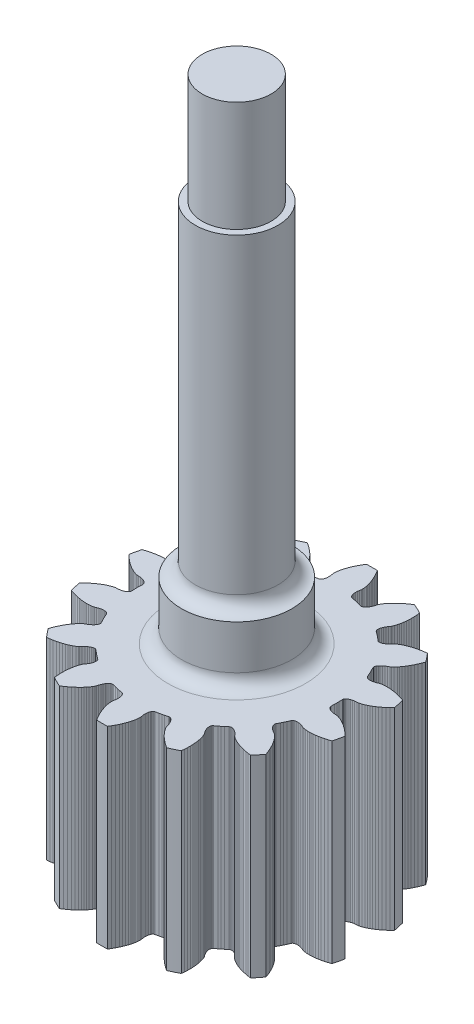
from build123d import *

# Parameters (mm, degrees)
SKETCH1_R           = 2
BOSS_EXTRUDE1_DEPTH = 2.1
SKETCH2_R           = 1.5
BOSS_EXTRUDE3_DEPTH = 15.8
BOSS_EXTRUDE4_DEPTH = 7
FILLET1_R           = 0.5
CUT_EXTRUDE3_START  = -4
SKETCH5_R           = 1.5
SKETCH5_R_2         = 1.25
CUT_EXTRUDE3_DEPTH  = 4


with BuildPart() as part:
    # Sketch1 → Boss-Extrude1 (new body)
    with BuildSketch(Plane(origin=(0, 0, 0), x_dir=(1, 0, 0), z_dir=(0, 1, 0))):
        with Locations(Location((0, 0, 0), (0, 0, 270))):
            Circle(SKETCH1_R)
    extrude(amount=BOSS_EXTRUDE1_DEPTH)

    # Sketch2 → Boss-Extrude3 (add)
    with BuildSketch(Plane(origin=(0, 2.1, 0), x_dir=(1, 0, 0), z_dir=(0, 1, 0))):
        with Locations(Location((0, 0, 0), (0, 0, 270))):
            Circle(SKETCH2_R)
    extrude(amount=BOSS_EXTRUDE3_DEPTH)

    # Sketch4 → Boss-Extrude4 (add)
    with BuildSketch(Plane.XZ):
        with BuildLine():
            Line((-3.859803511, -2.753642421), (-3.819636511, -2.656771321))
            Line((-3.819636511, -2.656771321), (-3.776760411, -2.564511521))
            Line((-3.776760411, -2.564511521), (-3.734616711, -2.483015421))
            Line((-3.734616711, -2.483015421), (-3.693090411, -2.410263021))
            Line((-3.693090411, -2.410263021), (-3.651178211, -2.343451621))
            Line((-3.651178211, -2.343451621), (-3.610740011, -2.284642221))
            Line((-3.610740011, -2.284642221), (-3.572343511, -2.233508821))
            Line((-3.572343511, -2.233508821), (-3.535491911, -2.188524621))
            Line((-3.535491911, -2.188524621), (-3.473146411, -2.121251821))
            Line((-3.473146411, -2.121251821), (-3.424934411, -2.077178821))
            Line((-3.424934411, -2.077178821), (-3.394910511, -2.054040521))
            Line((-3.394910511, -2.054040521), (-3.341224911, -2.025989321))
            Line((-3.341224911, -2.025989321), (-3.281336111, -1.989223521))
            Line((-3.281336111, -1.989223521), (-3.230434711, -1.951380621))
            Line((-3.230434711, -1.951380621), (-3.188477311, -1.913149921))
            Line((-3.188477311, -1.913149921), (-3.155406711, -1.875203321))
            Line((-3.155406711, -1.875203321), (-3.131116811, -1.838222021))
            Line((-3.131116811, -1.838222021), (-3.115447411, -1.802861521))
            Line((-3.115447411, -1.802861521), (-3.108211511, -1.769786521))
            Line((-3.108211511, -1.769786521), (-3.107677411, -1.754301221))
            Line((-3.107677411, -1.754301221), (-3.109172511, -1.739626721))
            Line((-3.109172511, -1.739626721), (-3.112653111, -1.725830621))
            Line((-3.112653111, -1.725830621), (-3.118075811, -1.713003121))
            Line((-3.118075811, -1.713003121), (-3.173896811, -1.608060321))
            Line((-3.173896811, -1.608060321), (-3.212259611, -1.530726921))
            Line((-3.212259611, -1.530726921), (-3.248802511, -1.452517121))
            Line((-3.248802511, -1.452517121), (-3.296046211, -1.343443721))
            Line((-3.296046211, -1.343443721), (-3.302694211, -1.331206321))
            Line((-3.302694211, -1.331206321), (-3.311310311, -1.319883321))
            Line((-3.311310311, -1.319883321), (-3.321851111, -1.309565021))
            Line((-3.321851111, -1.309565021), (-3.334291011, -1.300327721))
            Line((-3.334291011, -1.300327721), (-3.364661511, -1.285363021))
            Line((-3.364661511, -1.285363021), (-3.402077211, -1.275566921))
            Line((-3.402077211, -1.275566921), (-3.446134811, -1.271500121))
            Line((-3.446134811, -1.271500121), (-3.496421911, -1.273696321))
            Line((-3.496421911, -1.273696321), (-3.552471911, -1.282663521))
            Line((-3.552471911, -1.282663521), (-3.613795211, -1.298865121))
            Line((-3.613795211, -1.298865121), (-3.679879811, -1.322765021))
            Line((-3.679879811, -1.322765021), (-3.735283611, -1.347248421))
            Line((-3.735283611, -1.347248421), (-3.772093511, -1.356295621))
            Line((-3.772093511, -1.356295621), (-3.836610811, -1.366510221))
            Line((-3.836610811, -1.366510221), (-3.928078611, -1.373310021))
            Line((-3.928078611, -1.373310021), (-3.986225211, -1.374074621))
            Line((-3.986225211, -1.374074621), (-4.050142711, -1.372213021))
            Line((-4.050142711, -1.372213021), (-4.121334611, -1.367161721))
            Line((-4.121334611, -1.367161721), (-4.199701711, -1.358273821))
            Line((-4.199701711, -1.358273821), (-4.282473011, -1.345380021))
            Line((-4.282473011, -1.345380021), (-4.372465411, -1.327517321))
            Line((-4.372465411, -1.327517321), (-4.471329811, -1.303516121))
            Line((-4.471329811, -1.303516121), (-4.572110411, -1.274521821))
            Line((-4.572110411, -1.274521821), (-4.675267811, -1.240141921))
            ThreePointArc((-4.675267811, -1.240141921), (-4.723140522, -1.048323303), (-4.763235176, -0.854729404))
            Line((-4.763235176, -0.854729404), (-4.685210401, -0.778995911))
            Line((-4.685210401, -0.778995911), (-4.606990401, -0.709145911))
            Line((-4.606990401, -0.709145911), (-4.528330401, -0.644625911))
            Line((-4.528330401, -0.644625911), (-4.455000401, -0.589485911))
            Line((-4.455000401, -0.589485911), (-4.386020401, -0.541955911))
            Line((-4.386020401, -0.541955911), (-4.319270401, -0.499945911))
            Line((-4.319270401, -0.499945911), (-4.257320401, -0.464505911))
            Line((-4.257320401, -0.464505911), (-4.200540401, -0.435095911))
            Line((-4.200540401, -0.435095911), (-4.147820401, -0.410555911))
            Line((-4.147820401, -0.410555911), (-4.062460401, -0.376995911))
            Line((-4.062460401, -0.376995911), (-3.999900401, -0.358205911))
            Line((-3.999900401, -0.358205911), (-3.962810401, -0.350385911))
            Line((-3.962810401, -0.350385911), (-3.902270401, -0.348405911))
            Line((-3.902270401, -0.348405911), (-3.832360401, -0.341265911))
            Line((-3.832360401, -0.341265911), (-3.770080401, -0.329255911))
            Line((-3.770080401, -0.329255911), (-3.715690401, -0.313015911))
            Line((-3.715690401, -0.313015911), (-3.669430401, -0.293175911))
            Line((-3.669430401, -0.293175911), (-3.631500401, -0.270395911))
            Line((-3.631500401, -0.270395911), (-3.602040401, -0.245335911))
            Line((-3.602040401, -0.245335911), (-3.581170401, -0.218675911))
            Line((-3.581170401, -0.218675911), (-3.573970401, -0.204955911))
            Line((-3.573970401, -0.204955911), (-3.568950401, -0.191085911))
            Line((-3.568950401, -0.191085911), (-3.566100401, -0.177145911))
            Line((-3.566100401, -0.177145911), (-3.565420401, -0.163235911))
            Line((-3.565420401, -0.163235911), (-3.570180401, -0.044465911))
            Line((-3.570180401, -0.044465911), (-3.571190401, 0.041854089))
            Line((-3.571190401, 0.041854089), (-3.570180401, 0.128174089))
            Line((-3.570180401, 0.128174089), (-3.565420401, 0.246944089))
            Line((-3.565420401, 0.246944089), (-3.566100401, 0.260854089))
            Line((-3.566100401, 0.260854089), (-3.568950401, 0.274794089))
            Line((-3.568950401, 0.274794089), (-3.573970401, 0.288664089))
            Line((-3.573970401, 0.288664089), (-3.581170401, 0.302384089))
            Line((-3.581170401, 0.302384089), (-3.602040401, 0.329044089))
            Line((-3.602040401, 0.329044089), (-3.631500401, 0.354104089))
            Line((-3.631500401, 0.354104089), (-3.669430401, 0.376884089))
            Line((-3.669430401, 0.376884089), (-3.715690401, 0.396724089))
            Line((-3.715690401, 0.396724089), (-3.770080401, 0.412964089))
            Line((-3.770080401, 0.412964089), (-3.832360401, 0.424974089))
            Line((-3.832360401, 0.424974089), (-3.902270401, 0.432114089))
            Line((-3.902270401, 0.432114089), (-3.962810401, 0.434094089))
            Line((-3.962810401, 0.434094089), (-3.999900401, 0.441914089))
            Line((-3.999900401, 0.441914089), (-4.062460401, 0.460704089))
            Line((-4.062460401, 0.460704089), (-4.147820401, 0.494264089))
            Line((-4.147820401, 0.494264089), (-4.200540401, 0.518804089))
            Line((-4.200540401, 0.518804089), (-4.257320401, 0.548214089))
            Line((-4.257320401, 0.548214089), (-4.319270401, 0.583654089))
            Line((-4.319270401, 0.583654089), (-4.386020401, 0.625664089))
            Line((-4.386020401, 0.625664089), (-4.455000401, 0.673194089))
            Line((-4.455000401, 0.673194089), (-4.528330401, 0.728334089))
            Line((-4.528330401, 0.728334089), (-4.606990401, 0.792854089))
            Line((-4.606990401, 0.792854089), (-4.685210401, 0.862704089))
            Line((-4.685210401, 0.862704089), (-4.763235101, 0.938437589))
            ThreePointArc((-4.763235101, 0.938437589), (-4.723141362, 1.13202383), (-4.675270179, 1.32383491))
            Line((-4.675270179, 1.32383491), (-4.572112903, 1.358214815))
            Line((-4.572112903, 1.358214815), (-4.471332303, 1.387209115))
            Line((-4.471332303, 1.387209115), (-4.372467903, 1.411210315))
            Line((-4.372467903, 1.411210315), (-4.282475503, 1.429073015))
            Line((-4.282475503, 1.429073015), (-4.199704203, 1.441966815))
            Line((-4.199704203, 1.441966815), (-4.121337103, 1.450854715))
            Line((-4.121337103, 1.450854715), (-4.050145203, 1.455906015))
            Line((-4.050145203, 1.455906015), (-3.986227703, 1.457767615))
            Line((-3.986227703, 1.457767615), (-3.928081103, 1.457003015))
            Line((-3.928081103, 1.457003015), (-3.836613303, 1.450203215))
            Line((-3.836613303, 1.450203215), (-3.772096003, 1.439988615))
            Line((-3.772096003, 1.439988615), (-3.735286103, 1.430941415))
            Line((-3.735286103, 1.430941415), (-3.679882303, 1.406458015))
            Line((-3.679882303, 1.406458015), (-3.613797703, 1.382558115))
            Line((-3.613797703, 1.382558115), (-3.552474403, 1.366356515))
            Line((-3.552474403, 1.366356515), (-3.496424403, 1.357389315))
            Line((-3.496424403, 1.357389315), (-3.446137303, 1.355193115))
            Line((-3.446137303, 1.355193115), (-3.402079703, 1.359259915))
            Line((-3.402079703, 1.359259915), (-3.364664003, 1.369056015))
            Line((-3.364664003, 1.369056015), (-3.334293503, 1.384020715))
            Line((-3.334293503, 1.384020715), (-3.321853603, 1.393258015))
            Line((-3.321853603, 1.393258015), (-3.311312803, 1.403576315))
            Line((-3.311312803, 1.403576315), (-3.302696703, 1.414899315))
            Line((-3.302696703, 1.414899315), (-3.296048703, 1.427136715))
            Line((-3.296048703, 1.427136715), (-3.248805003, 1.536210115))
            Line((-3.248805003, 1.536210115), (-3.212262103, 1.614419915))
            Line((-3.212262103, 1.614419915), (-3.173899303, 1.691753315))
            Line((-3.173899303, 1.691753315), (-3.118078303, 1.796696115))
            Line((-3.118078303, 1.796696115), (-3.112655603, 1.809523615))
            Line((-3.112655603, 1.809523615), (-3.109175003, 1.823319715))
            Line((-3.109175003, 1.823319715), (-3.107679903, 1.837994215))
            Line((-3.107679903, 1.837994215), (-3.108214003, 1.853479515))
            Line((-3.108214003, 1.853479515), (-3.115449903, 1.886554515))
            Line((-3.115449903, 1.886554515), (-3.131119303, 1.921915015))
            Line((-3.131119303, 1.921915015), (-3.155409203, 1.958896315))
            Line((-3.155409203, 1.958896315), (-3.188479803, 1.996842915))
            Line((-3.188479803, 1.996842915), (-3.230437203, 2.035073615))
            Line((-3.230437203, 2.035073615), (-3.281338603, 2.072916515))
            Line((-3.281338603, 2.072916515), (-3.341227403, 2.109682315))
            Line((-3.341227403, 2.109682315), (-3.394913003, 2.137733515))
            Line((-3.394913003, 2.137733515), (-3.424936903, 2.160871815))
            Line((-3.424936903, 2.160871815), (-3.473148903, 2.204944815))
            Line((-3.473148903, 2.204944815), (-3.535494403, 2.272217615))
            Line((-3.535494403, 2.272217615), (-3.572346003, 2.317201815))
            Line((-3.572346003, 2.317201815), (-3.610742503, 2.368335215))
            Line((-3.610742503, 2.368335215), (-3.651180703, 2.427144615))
            Line((-3.651180703, 2.427144615), (-3.693092903, 2.493956015))
            Line((-3.693092903, 2.493956015), (-3.734619203, 2.566708415))
            Line((-3.734619203, 2.566708415), (-3.776762903, 2.648204515))
            Line((-3.776762903, 2.648204515), (-3.819639003, 2.740464315))
            Line((-3.819639003, 2.740464315), (-3.859806003, 2.837335415))
            Line((-3.859806003, 2.837335415), (-3.897244203, 2.939422615))
            ThreePointArc((-3.897244203, 2.939422615), (-3.777122614, 3.096447815), (-3.650763527, 3.248498762))
            Line((-3.650763527, 3.248498762), (-3.542905072, 3.234715701))
            Line((-3.542905072, 3.234715701), (-3.439524772, 3.217111601))
            Line((-3.439524772, 3.217111601), (-3.340037372, 3.195840301))
            Line((-3.340037372, 3.195840301), (-3.251206672, 3.172887901))
            Line((-3.251206672, 3.172887901), (-3.171037872, 3.148591601))
            Line((-3.171037872, 3.148591601), (-3.096575172, 3.122597101))
            Line((-3.096575172, 3.122597101), (-3.030241872, 3.096259201))
            Line((-3.030241872, 3.096259201), (-2.971846472, 3.070203601))
            Line((-2.971846472, 3.070203601), (-2.919789972, 3.044285901))
            Line((-2.919789972, 3.044285901), (-2.840330572, 2.998473101))
            Line((-2.840330572, 2.998473101), (-2.786634472, 2.961277101))
            Line((-2.786634472, 2.961277101), (-2.757395272, 2.937154601))
            Line((-2.757395272, 2.937154601), (-2.718101172, 2.891057101))
            Line((-2.718101172, 2.891057101), (-2.668930772, 2.840850901))
            Line((-2.668930772, 2.840850901), (-2.620709972, 2.799646601))
            Line((-2.620709972, 2.799646601), (-2.574101472, 2.767248201))
            Line((-2.574101472, 2.767248201), (-2.529747272, 2.743450801))
            Line((-2.529747272, 2.743450801), (-2.488288172, 2.727999001))
            Line((-2.488288172, 2.727999001), (-2.450327472, 2.720590901))
            Line((-2.450327472, 2.720590901), (-2.416471572, 2.720896301))
            Line((-2.416471572, 2.720896301), (-2.401255772, 2.723821401))
            Line((-2.401255772, 2.723821401), (-2.387281872, 2.728544401))
            Line((-2.387281872, 2.728544401), (-2.374606172, 2.735007601))
            Line((-2.374606172, 2.735007601), (-2.363306872, 2.743148701))
            Line((-2.363306872, 2.743148701), (-2.273416572, 2.820922101))
            Line((-2.273416572, 2.820922101), (-2.206558672, 2.875531401))
            Line((-2.206558672, 2.875531401), (-2.138441172, 2.928561401))
            Line((-2.138441172, 2.928561401), (-2.042615272, 2.998891801))
            Line((-2.042615272, 2.998891801), (-2.032163972, 3.008096201))
            Line((-2.032163972, 3.008096201), (-2.023042172, 3.019015801))
            Line((-2.023042172, 3.019015801), (-2.015328072, 3.031588401))
            Line((-2.015328072, 3.031588401), (-2.009090472, 3.045771901))
            Line((-2.009090472, 3.045771901), (-2.001259072, 3.078711001))
            Line((-2.001259072, 3.078711001), (-2.000034372, 3.117368401))
            Line((-2.000034372, 3.117368401), (-2.005873272, 3.161226301))
            Line((-2.005873272, 3.161226301), (-2.019204372, 3.209763901))
            Line((-2.019204372, 3.209763901), (-2.040419072, 3.262413201))
            Line((-2.040419072, 3.262413201), (-2.069860172, 3.318593801))
            Line((-2.069860172, 3.318593801), (-2.107866072, 3.377703301))
            Line((-2.107866072, 3.377703301), (-2.144064172, 3.426269901))
            Line((-2.144064172, 3.426269901), (-2.161075472, 3.460143701))
            Line((-2.161075472, 3.460143701), (-2.185390372, 3.520770501))
            Line((-2.185390372, 3.520770501), (-2.212373172, 3.608431901))
            Line((-2.212373172, 3.608431901), (-2.226057372, 3.664950501))
            Line((-2.226057372, 3.664950501), (-2.238465472, 3.727679801))
            Line((-2.238465472, 3.727679801), (-2.249382572, 3.798210701))
            Line((-2.249382572, 3.798210701), (-2.258155772, 3.876590801))
            Line((-2.258155772, 3.876590801), (-2.264003672, 3.960156001))
            Line((-2.264003672, 3.960156001), (-2.266613972, 4.051866901))
            Line((-2.266613972, 4.051866901), (-2.265213972, 4.153593301))
            Line((-2.265213972, 4.153593301), (-2.259372372, 4.258298901))
            Line((-2.259372372, 4.258298901), (-2.248809072, 4.366520201))
            ThreePointArc((-2.248809072, 4.366520201), (-2.0724582, 4.455873191), (-1.892646011, 4.538038654))
            Line((-1.892646011, 4.538038654), (-1.801449089, 4.478822413))
            Line((-1.801449089, 4.478822413), (-1.715944789, 4.418106613))
            Line((-1.715944789, 4.418106613), (-1.635538989, 4.355775913))
            Line((-1.635538989, 4.355775913), (-1.565463989, 4.296554213))
            Line((-1.565463989, 4.296554213), (-1.503776189, 4.239880113))
            Line((-1.503776189, 4.239880113), (-1.447966189, 4.184151813))
            Line((-1.447966189, 4.184151813), (-1.399629589, 4.131641113))
            Line((-1.399629589, 4.131641113), (-1.358322189, 4.082829013))
            Line((-1.358322189, 4.082829013), (-1.322666189, 4.036891513))
            Line((-1.322666189, 4.036891513), (-1.270953189, 3.961139513))
            Line((-1.270953189, 3.961139513), (-1.238713389, 3.904329113))
            Line((-1.238713389, 3.904329113), (-1.222836189, 3.869909213))
            Line((-1.222836189, 3.869909213), (-1.207434389, 3.811327613))
            Line((-1.207434389, 3.811327613), (-1.184916989, 3.744759213))
            Line((-1.184916989, 3.744759213), (-1.159349489, 3.686713213))
            Line((-1.159349489, 3.686713213), (-1.131413689, 3.637300613))
            Line((-1.131413689, 3.637300613), (-1.101777289, 3.596615313))
            Line((-1.101777289, 3.596615313), (-1.071128289, 3.564705313))
            Line((-1.071128289, 3.564705313), (-1.040141089, 3.541560313))
            Line((-1.040141089, 3.541560313), (-1.009505489, 3.527145913))
            Line((-1.009505489, 3.527145913), (-0.994527389, 3.523179413))
            Line((-0.994527389, 3.523179413), (-0.979888089, 3.521371713))
            Line((-0.979888089, 3.521371713), (-0.965663389, 3.521695113))
            Line((-0.965663389, 3.521695113), (-0.951950789, 3.524127413))
            Line((-0.951950789, 3.524127413), (-0.837217789, 3.555196813))
            Line((-0.837217789, 3.555196813), (-0.753286789, 3.575389513))
            Line((-0.753286789, 3.575389513), (-0.668906289, 3.593612913))
            Line((-0.668906289, 3.593612913), (-0.552054889, 3.615401013))
            Line((-0.552054889, 3.615401013), (-0.538644889, 3.619159213))
            Line((-0.538644889, 3.619159213), (-0.525688589, 3.625039713))
            Line((-0.525688589, 3.625039713), (-0.513283389, 3.633020213))
            Line((-0.513283389, 3.633020213), (-0.501509589, 3.643092713))
            Line((-0.501509589, 3.643092713), (-0.480161989, 3.669371813))
            Line((-0.480161989, 3.669371813), (-0.462285789, 3.703669613))
            Line((-0.462285789, 3.703669613), (-0.448517189, 3.745717613))
            Line((-0.448517189, 3.745717613), (-0.439468389, 3.795232613))
            Line((-0.439468389, 3.795232613), (-0.435738489, 3.851872713))
            Line((-0.435738489, 3.851872713), (-0.437888189, 3.915263713))
            Line((-0.437888189, 3.915263713), (-0.446483689, 3.985009713))
            Line((-0.446483689, 3.985009713), (-0.458024689, 4.044472413))
            Line((-0.458024689, 4.044472413), (-0.458654089, 4.082372613))
            Line((-0.458654089, 4.082372613), (-0.454256089, 4.147545313))
            Line((-0.454256089, 4.147545313), (-0.440531889, 4.238232913))
            Line((-0.440531889, 4.238232913), (-0.428338489, 4.295091813))
            Line((-0.428338489, 4.295091813), (-0.412300589, 4.356992513))
            Line((-0.412300589, 4.356992513), (-0.391534289, 4.425275413))
            Line((-0.391534289, 4.425275413), (-0.365430889, 4.499700013))
            Line((-0.365430889, 4.499700013), (-0.334441989, 4.577526913))
            Line((-0.334441989, 4.577526913), (-0.297001989, 4.661288213))
            Line((-0.297001989, 4.661288213), (-0.251603089, 4.752333113))
            Line((-0.251603089, 4.752333113), (-0.200909989, 4.844135013))
            Line((-0.200909989, 4.844135013), (-0.144437389, 4.937055813))
            ThreePointArc((-0.144437389, 4.937055813), (0.053217989, 4.941044579), (0.250873367, 4.937055805))
            Line((0.250873367, 4.937055805), (0.307345967, 4.844134979))
            Line((0.307345967, 4.844134979), (0.358039167, 4.752333079))
            Line((0.358039167, 4.752333079), (0.403437967, 4.661288179))
            Line((0.403437967, 4.661288179), (0.440878067, 4.577526879))
            Line((0.440878067, 4.577526879), (0.471866867, 4.499699979))
            Line((0.471866867, 4.499699979), (0.497970367, 4.425275379))
            Line((0.497970367, 4.425275379), (0.518736567, 4.356992479))
            Line((0.518736567, 4.356992479), (0.534774467, 4.295091779))
            Line((0.534774467, 4.295091779), (0.546967967, 4.238232879))
            Line((0.546967967, 4.238232879), (0.560692167, 4.147545279))
            Line((0.560692167, 4.147545279), (0.565090067, 4.082372579))
            Line((0.565090067, 4.082372579), (0.564460767, 4.044472379))
            Line((0.564460767, 4.044472379), (0.552919667, 3.985009679))
            Line((0.552919667, 3.985009679), (0.544324267, 3.915263679))
            Line((0.544324267, 3.915263679), (0.542174467, 3.851872679))
            Line((0.542174467, 3.851872679), (0.545904467, 3.795232579))
            Line((0.545904467, 3.795232579), (0.554953167, 3.745717579))
            Line((0.554953167, 3.745717579), (0.568721867, 3.703669579))
            Line((0.568721867, 3.703669579), (0.586598067, 3.669371779))
            Line((0.586598067, 3.669371779), (0.607945567, 3.643092679))
            Line((0.607945567, 3.643092679), (0.619719467, 3.633020179))
            Line((0.619719467, 3.633020179), (0.632124667, 3.625039679))
            Line((0.632124667, 3.625039679), (0.645080967, 3.619159179))
            Line((0.645080967, 3.619159179), (0.658490867, 3.615400979))
            Line((0.658490867, 3.615400979), (0.775342267, 3.593612879))
            Line((0.775342267, 3.593612879), (0.859722867, 3.575389479))
            Line((0.859722867, 3.575389479), (0.943653867, 3.555196779))
            Line((0.943653867, 3.555196779), (1.058386867, 3.524127379))
            Line((1.058386867, 3.524127379), (1.072099367, 3.521695079))
            Line((1.072099367, 3.521695079), (1.086324067, 3.521371679))
            Line((1.086324067, 3.521371679), (1.100963367, 3.523179379))
            Line((1.100963367, 3.523179379), (1.115941567, 3.527145879))
            Line((1.115941567, 3.527145879), (1.146577167, 3.541560279))
            Line((1.146577167, 3.541560279), (1.177564267, 3.564705279))
            Line((1.177564267, 3.564705279), (1.208213367, 3.596615279))
            Line((1.208213367, 3.596615279), (1.237849767, 3.637300579))
            Line((1.237849767, 3.637300579), (1.265785467, 3.686713179))
            Line((1.265785467, 3.686713179), (1.291352967, 3.744759179))
            Line((1.291352967, 3.744759179), (1.313870467, 3.811327579))
            Line((1.313870467, 3.811327579), (1.329272167, 3.869909179))
            Line((1.329272167, 3.869909179), (1.345149467, 3.904329079))
            Line((1.345149467, 3.904329079), (1.377389267, 3.961139479))
            Line((1.377389267, 3.961139479), (1.429102167, 4.036891479))
            Line((1.429102167, 4.036891479), (1.464758267, 4.082828979))
            Line((1.464758267, 4.082828979), (1.506065567, 4.131641079))
            Line((1.506065567, 4.131641079), (1.554402267, 4.184151779))
            Line((1.554402267, 4.184151779), (1.610212267, 4.239880079))
            Line((1.610212267, 4.239880079), (1.671900067, 4.296554179))
            Line((1.671900067, 4.296554179), (1.741975067, 4.355775879))
            Line((1.741975067, 4.355775879), (1.822380867, 4.418106579))
            Line((1.822380867, 4.418106579), (1.907885167, 4.478822379))
            Line((1.907885167, 4.478822379), (1.999094892, 4.53803307))
            ThreePointArc((1.999094892, 4.53803307), (2.178906842, 4.455867084), (2.355257454, 4.366513581))
            Line((2.355257454, 4.366513581), (2.365820736, 4.25829224))
            Line((2.365820736, 4.25829224), (2.371662236, 4.15358664))
            Line((2.371662236, 4.15358664), (2.373062336, 4.05186024))
            Line((2.373062336, 4.05186024), (2.370452036, 3.96014934))
            Line((2.370452036, 3.96014934), (2.364604136, 3.87658414))
            Line((2.364604136, 3.87658414), (2.355830936, 3.79820404))
            Line((2.355830936, 3.79820404), (2.344913836, 3.72767314))
            Line((2.344913836, 3.72767314), (2.332505736, 3.66494384))
            Line((2.332505736, 3.66494384), (2.318821536, 3.60842524))
            Line((2.318821536, 3.60842524), (2.291838636, 3.52076384))
            Line((2.291838636, 3.52076384), (2.267523736, 3.46013704))
            Line((2.267523736, 3.46013704), (2.250512436, 3.42626324))
            Line((2.250512436, 3.42626324), (2.214314436, 3.37769664))
            Line((2.214314436, 3.37769664), (2.176308536, 3.31858714))
            Line((2.176308536, 3.31858714), (2.146867336, 3.26240654))
            Line((2.146867336, 3.26240654), (2.125652736, 3.20975724))
            Line((2.125652736, 3.20975724), (2.112321636, 3.16121964))
            Line((2.112321636, 3.16121964), (2.106482736, 3.11736174))
            Line((2.106482736, 3.11736174), (2.107707436, 3.07870434))
            Line((2.107707436, 3.07870434), (2.115538836, 3.04576524))
            Line((2.115538836, 3.04576524), (2.121776436, 3.03158174))
            Line((2.121776436, 3.03158174), (2.129490536, 3.01900914))
            Line((2.129490536, 3.01900914), (2.138612336, 3.00808954))
            Line((2.138612336, 3.00808954), (2.149063636, 2.99888514))
            Line((2.149063636, 2.99888514), (2.244889536, 2.92855474))
            Line((2.244889536, 2.92855474), (2.313006936, 2.87552474))
            Line((2.313006936, 2.87552474), (2.379864936, 2.82091544))
            Line((2.379864936, 2.82091544), (2.469755236, 2.74314204))
            Line((2.469755236, 2.74314204), (2.481054436, 2.73500094))
            Line((2.481054436, 2.73500094), (2.493730136, 2.72853774))
            Line((2.493730136, 2.72853774), (2.507704036, 2.72381474))
            Line((2.507704036, 2.72381474), (2.522919936, 2.72088964))
            Line((2.522919936, 2.72088964), (2.556775836, 2.72058424))
            Line((2.556775836, 2.72058424), (2.594736536, 2.72799234))
            Line((2.594736536, 2.72799234), (2.636195636, 2.74344414))
            Line((2.636195636, 2.74344414), (2.680549736, 2.76724154))
            Line((2.680549736, 2.76724154), (2.727158336, 2.79963994))
            Line((2.727158336, 2.79963994), (2.775379036, 2.84084424))
            Line((2.775379036, 2.84084424), (2.824549536, 2.89105044))
            Line((2.824549536, 2.89105044), (2.863843636, 2.93714794))
            Line((2.863843636, 2.93714794), (2.893082736, 2.96127044))
            Line((2.893082736, 2.96127044), (2.946778936, 2.99846644))
            Line((2.946778936, 2.99846644), (3.026238236, 3.04427924))
            Line((3.026238236, 3.04427924), (3.078294836, 3.07019694))
            Line((3.078294836, 3.07019694), (3.136690236, 3.09625254))
            Line((3.136690236, 3.09625254), (3.203023536, 3.12259044))
            Line((3.203023536, 3.12259044), (3.277486236, 3.14858494))
            Line((3.277486236, 3.14858494), (3.357654936, 3.17288124))
            Line((3.357654936, 3.17288124), (3.446485636, 3.19583364))
            Line((3.446485636, 3.19583364), (3.545973136, 3.21710494))
            Line((3.545973136, 3.21710494), (3.649353436, 3.23470904))
            Line((3.649353436, 3.23470904), (3.757211936, 3.24849214))
            ThreePointArc((3.757211936, 3.24849214), (3.88356659, 3.096445896), (4.003684153, 2.939425739))
            Line((4.003684153, 2.939425739), (3.966245901, 2.837338572))
            Line((3.966245901, 2.837338572), (3.926078901, 2.740467472))
            Line((3.926078901, 2.740467472), (3.883202901, 2.648207672))
            Line((3.883202901, 2.648207672), (3.841059201, 2.566711572))
            Line((3.841059201, 2.566711572), (3.799532801, 2.493959172))
            Line((3.799532801, 2.493959172), (3.757620601, 2.427147772))
            Line((3.757620601, 2.427147772), (3.717182401, 2.368338372))
            Line((3.717182401, 2.368338372), (3.678786001, 2.317204972))
            Line((3.678786001, 2.317204972), (3.641934401, 2.272220772))
            Line((3.641934401, 2.272220772), (3.579588801, 2.204947972))
            Line((3.579588801, 2.204947972), (3.531376901, 2.160874972))
            Line((3.531376901, 2.160874972), (3.501352901, 2.137736672))
            Line((3.501352901, 2.137736672), (3.447667301, 2.109685472))
            Line((3.447667301, 2.109685472), (3.387778501, 2.072919672))
            Line((3.387778501, 2.072919672), (3.336877101, 2.035076772))
            Line((3.336877101, 2.035076772), (3.294919701, 1.996846072))
            Line((3.294919701, 1.996846072), (3.261849201, 1.958899472))
            Line((3.261849201, 1.958899472), (3.237559301, 1.921918172))
            Line((3.237559301, 1.921918172), (3.221889901, 1.886557672))
            Line((3.221889901, 1.886557672), (3.214654001, 1.853482672))
            Line((3.214654001, 1.853482672), (3.214119901, 1.837997372))
            Line((3.214119901, 1.837997372), (3.215615001, 1.823322872))
            Line((3.215615001, 1.823322872), (3.219095601, 1.809526772))
            Line((3.219095601, 1.809526772), (3.224518201, 1.796699272))
            Line((3.224518201, 1.796699272), (3.280339201, 1.691756472))
            Line((3.280339201, 1.691756472), (3.318702001, 1.614423072))
            Line((3.318702001, 1.614423072), (3.355244901, 1.536213272))
            Line((3.355244901, 1.536213272), (3.402488701, 1.427139872))
            Line((3.402488701, 1.427139872), (3.409136701, 1.414902472))
            Line((3.409136701, 1.414902472), (3.417752801, 1.403579472))
            Line((3.417752801, 1.403579472), (3.428293601, 1.393261172))
            Line((3.428293601, 1.393261172), (3.440733401, 1.384023872))
            Line((3.440733401, 1.384023872), (3.471104001, 1.369059172))
            Line((3.471104001, 1.369059172), (3.508519701, 1.359263072))
            Line((3.508519701, 1.359263072), (3.552577301, 1.355196272))
            Line((3.552577301, 1.355196272), (3.602864401, 1.357392472))
            Line((3.602864401, 1.357392472), (3.658914301, 1.366359672))
            Line((3.658914301, 1.366359672), (3.720237601, 1.382561272))
            Line((3.720237601, 1.382561272), (3.786322301, 1.406461172))
            Line((3.786322301, 1.406461172), (3.841726001, 1.430944572))
            Line((3.841726001, 1.430944572), (3.878535901, 1.439991772))
            Line((3.878535901, 1.439991772), (3.943053201, 1.450206372))
            Line((3.943053201, 1.450206372), (4.034521101, 1.457006172))
            Line((4.034521101, 1.457006172), (4.092667701, 1.457770772))
            Line((4.092667701, 1.457770772), (4.156585201, 1.455909172))
            Line((4.156585201, 1.455909172), (4.227777001, 1.450857872))
            Line((4.227777001, 1.450857872), (4.306144201, 1.441969972))
            Line((4.306144201, 1.441969972), (4.388915501, 1.429076172))
            Line((4.388915501, 1.429076172), (4.478907901, 1.411213472))
            Line((4.478907901, 1.411213472), (4.577772301, 1.387212272))
            Line((4.577772301, 1.387212272), (4.678552901, 1.358217972))
            Line((4.678552901, 1.358217972), (4.781710106, 1.323838127))
            ThreePointArc((4.781710106, 1.323838127), (4.829581632, 1.132025926), (4.869675624, 0.938438543))
            Line((4.869675624, 0.938438543), (4.791653584, 0.862691003))
            Line((4.791653584, 0.862691003), (4.713433584, 0.792841003))
            Line((4.713433584, 0.792841003), (4.634773584, 0.728321003))
            Line((4.634773584, 0.728321003), (4.561443584, 0.673181003))
            Line((4.561443584, 0.673181003), (4.492463584, 0.625651003))
            Line((4.492463584, 0.625651003), (4.425713584, 0.583641003))
            Line((4.425713584, 0.583641003), (4.363763584, 0.548201003))
            Line((4.363763584, 0.548201003), (4.306983584, 0.518791003))
            Line((4.306983584, 0.518791003), (4.254263584, 0.494251003))
            Line((4.254263584, 0.494251003), (4.168903584, 0.460691003))
            Line((4.168903584, 0.460691003), (4.106343584, 0.441901003))
            Line((4.106343584, 0.441901003), (4.069253584, 0.434081003))
            Line((4.069253584, 0.434081003), (4.008713584, 0.432101003))
            Line((4.008713584, 0.432101003), (3.938803584, 0.424961003))
            Line((3.938803584, 0.424961003), (3.876523584, 0.412951003))
            Line((3.876523584, 0.412951003), (3.822133584, 0.396711003))
            Line((3.822133584, 0.396711003), (3.775873584, 0.376871003))
            Line((3.775873584, 0.376871003), (3.737943584, 0.354091003))
            Line((3.737943584, 0.354091003), (3.708483584, 0.329031003))
            Line((3.708483584, 0.329031003), (3.687613584, 0.302371003))
            Line((3.687613584, 0.302371003), (3.680413584, 0.288651003))
            Line((3.680413584, 0.288651003), (3.675393584, 0.274781003))
            Line((3.675393584, 0.274781003), (3.672543584, 0.260841003))
            Line((3.672543584, 0.260841003), (3.671863584, 0.246931003))
            Line((3.671863584, 0.246931003), (3.676623584, 0.128161003))
            Line((3.676623584, 0.128161003), (3.677633584, 0.041841003))
            Line((3.677633584, 0.041841003), (3.676623584, -0.044478997))
            Line((3.676623584, -0.044478997), (3.671863584, -0.163248997))
            Line((3.671863584, -0.163248997), (3.672543584, -0.177158997))
            Line((3.672543584, -0.177158997), (3.675393584, -0.191098997))
            Line((3.675393584, -0.191098997), (3.680413584, -0.204968997))
            Line((3.680413584, -0.204968997), (3.687613584, -0.218688997))
            Line((3.687613584, -0.218688997), (3.708483584, -0.245348997))
            Line((3.708483584, -0.245348997), (3.737943584, -0.270408997))
            Line((3.737943584, -0.270408997), (3.775873584, -0.293188997))
            Line((3.775873584, -0.293188997), (3.822133584, -0.313028997))
            Line((3.822133584, -0.313028997), (3.876523584, -0.329268997))
            Line((3.876523584, -0.329268997), (3.938803584, -0.341278997))
            Line((3.938803584, -0.341278997), (4.008713584, -0.348418997))
            Line((4.008713584, -0.348418997), (4.069253584, -0.350398997))
            Line((4.069253584, -0.350398997), (4.106343584, -0.358218997))
            Line((4.106343584, -0.358218997), (4.168903584, -0.377008997))
            Line((4.168903584, -0.377008997), (4.254263584, -0.410568997))
            Line((4.254263584, -0.410568997), (4.306983584, -0.435108997))
            Line((4.306983584, -0.435108997), (4.363763584, -0.464518997))
            Line((4.363763584, -0.464518997), (4.425713584, -0.499958997))
            Line((4.425713584, -0.499958997), (4.492463584, -0.541968997))
            Line((4.492463584, -0.541968997), (4.561443584, -0.589498997))
            Line((4.561443584, -0.589498997), (4.634773584, -0.644638997))
            Line((4.634773584, -0.644638997), (4.713433584, -0.709158997))
            Line((4.713433584, -0.709158997), (4.791653584, -0.779008997))
            Line((4.791653584, -0.779008997), (4.869678284, -0.854742497))
            ThreePointArc((4.869678284, -0.854742497), (4.829584566, -1.04832987), (4.781713319, -1.240142073))
            Line((4.781713319, -1.240142073), (4.678556042, -1.274521977))
            Line((4.678556042, -1.274521977), (4.577775442, -1.303516277))
            Line((4.577775442, -1.303516277), (4.478911042, -1.327517477))
            Line((4.478911042, -1.327517477), (4.388918642, -1.345380177))
            Line((4.388918642, -1.345380177), (4.306147342, -1.358273977))
            Line((4.306147342, -1.358273977), (4.227780142, -1.367161877))
            Line((4.227780142, -1.367161877), (4.156588342, -1.372213177))
            Line((4.156588342, -1.372213177), (4.092670842, -1.374074777))
            Line((4.092670842, -1.374074777), (4.034524242, -1.373310177))
            Line((4.034524242, -1.373310177), (3.943056342, -1.366510377))
            Line((3.943056342, -1.366510377), (3.878539042, -1.356295777))
            Line((3.878539042, -1.356295777), (3.841729142, -1.347248577))
            Line((3.841729142, -1.347248577), (3.786325442, -1.322765177))
            Line((3.786325442, -1.322765177), (3.720240742, -1.298865277))
            Line((3.720240742, -1.298865277), (3.658917442, -1.282663677))
            Line((3.658917442, -1.282663677), (3.602867542, -1.273696477))
            Line((3.602867542, -1.273696477), (3.552580442, -1.271500277))
            Line((3.552580442, -1.271500277), (3.508522842, -1.275567077))
            Line((3.508522842, -1.275567077), (3.471107142, -1.285363177))
            Line((3.471107142, -1.285363177), (3.440736542, -1.300327877))
            Line((3.440736542, -1.300327877), (3.428296742, -1.309565177))
            Line((3.428296742, -1.309565177), (3.417755942, -1.319883477))
            Line((3.417755942, -1.319883477), (3.409139842, -1.331206477))
            Line((3.409139842, -1.331206477), (3.402491842, -1.343443877))
            Line((3.402491842, -1.343443877), (3.355248042, -1.452517277))
            Line((3.355248042, -1.452517277), (3.318705142, -1.530727077))
            Line((3.318705142, -1.530727077), (3.280342342, -1.608060477))
            Line((3.280342342, -1.608060477), (3.224521342, -1.713003277))
            Line((3.224521342, -1.713003277), (3.219098742, -1.725830777))
            Line((3.219098742, -1.725830777), (3.215618142, -1.739626877))
            Line((3.215618142, -1.739626877), (3.214123042, -1.754301377))
            Line((3.214123042, -1.754301377), (3.214657142, -1.769786677))
            Line((3.214657142, -1.769786677), (3.221893042, -1.802861677))
            Line((3.221893042, -1.802861677), (3.237562442, -1.838222177))
            Line((3.237562442, -1.838222177), (3.261852342, -1.875203477))
            Line((3.261852342, -1.875203477), (3.294922842, -1.913150077))
            Line((3.294922842, -1.913150077), (3.336880242, -1.951380777))
            Line((3.336880242, -1.951380777), (3.387781642, -1.989223677))
            Line((3.387781642, -1.989223677), (3.447670442, -2.025989477))
            Line((3.447670442, -2.025989477), (3.501356042, -2.054040677))
            Line((3.501356042, -2.054040677), (3.531380042, -2.077178977))
            Line((3.531380042, -2.077178977), (3.579591942, -2.121251977))
            Line((3.579591942, -2.121251977), (3.641937542, -2.188524777))
            Line((3.641937542, -2.188524777), (3.678789142, -2.233508977))
            Line((3.678789142, -2.233508977), (3.717185542, -2.284642377))
            Line((3.717185542, -2.284642377), (3.757623742, -2.343451777))
            Line((3.757623742, -2.343451777), (3.799535942, -2.410263177))
            Line((3.799535942, -2.410263177), (3.841062342, -2.483015577))
            Line((3.841062342, -2.483015577), (3.883206042, -2.564511677))
            Line((3.883206042, -2.564511677), (3.926082042, -2.656771477))
            Line((3.926082042, -2.656771477), (3.966249042, -2.753642577))
            Line((3.966249042, -2.753642577), (4.003687342, -2.855729777))
            ThreePointArc((4.003687342, -2.855729777), (3.883569954, -3.012750148), (3.757215462, -3.164796609))
            Line((3.757215462, -3.164796609), (3.649348344, -3.15102361))
            Line((3.649348344, -3.15102361), (3.545968044, -3.13341951))
            Line((3.545968044, -3.13341951), (3.446480544, -3.11214821))
            Line((3.446480544, -3.11214821), (3.357649844, -3.08919581))
            Line((3.357649844, -3.08919581), (3.277481144, -3.06489951))
            Line((3.277481144, -3.06489951), (3.203018444, -3.03890501))
            Line((3.203018444, -3.03890501), (3.136685144, -3.01256711))
            Line((3.136685144, -3.01256711), (3.078289744, -2.98651151))
            Line((3.078289744, -2.98651151), (3.026233144, -2.96059381))
            Line((3.026233144, -2.96059381), (2.946773844, -2.91478101))
            Line((2.946773844, -2.91478101), (2.893077644, -2.87758501))
            Line((2.893077644, -2.87758501), (2.863838544, -2.85346251))
            Line((2.863838544, -2.85346251), (2.824544444, -2.80736501))
            Line((2.824544444, -2.80736501), (2.775373944, -2.75715881))
            Line((2.775373944, -2.75715881), (2.727153244, -2.71595451))
            Line((2.727153244, -2.71595451), (2.680544644, -2.68355611))
            Line((2.680544644, -2.68355611), (2.636190544, -2.65975871))
            Line((2.636190544, -2.65975871), (2.594731444, -2.64430691))
            Line((2.594731444, -2.64430691), (2.556770744, -2.63689881))
            Line((2.556770744, -2.63689881), (2.522914844, -2.63720421))
            Line((2.522914844, -2.63720421), (2.507698944, -2.64012931))
            Line((2.507698944, -2.64012931), (2.493725044, -2.64485231))
            Line((2.493725044, -2.64485231), (2.481049344, -2.65131551))
            Line((2.481049344, -2.65131551), (2.469750144, -2.65945661))
            Line((2.469750144, -2.65945661), (2.379859844, -2.73723001))
            Line((2.379859844, -2.73723001), (2.313001844, -2.79183931))
            Line((2.313001844, -2.79183931), (2.244884444, -2.84486931))
            Line((2.244884444, -2.84486931), (2.149058544, -2.91519971))
            Line((2.149058544, -2.91519971), (2.138607244, -2.92440411))
            Line((2.138607244, -2.92440411), (2.129485444, -2.93532371))
            Line((2.129485444, -2.93532371), (2.121771344, -2.94789631))
            Line((2.121771344, -2.94789631), (2.115533744, -2.96207981))
            Line((2.115533744, -2.96207981), (2.107702344, -2.99501891))
            Line((2.107702344, -2.99501891), (2.106477644, -3.03367631))
            Line((2.106477644, -3.03367631), (2.112316544, -3.07753421))
            Line((2.112316544, -3.07753421), (2.125647644, -3.12607181))
            Line((2.125647644, -3.12607181), (2.146862244, -3.17872111))
            Line((2.146862244, -3.17872111), (2.176303444, -3.23490171))
            Line((2.176303444, -3.23490171), (2.214309344, -3.29401121))
            Line((2.214309344, -3.29401121), (2.250507344, -3.34257781))
            Line((2.250507344, -3.34257781), (2.267518644, -3.37645161))
            Line((2.267518644, -3.37645161), (2.291833544, -3.43707841))
            Line((2.291833544, -3.43707841), (2.318816444, -3.52473981))
            Line((2.318816444, -3.52473981), (2.332500644, -3.58125841))
            Line((2.332500644, -3.58125841), (2.344908744, -3.64398771))
            Line((2.344908744, -3.64398771), (2.355825844, -3.71451861))
            Line((2.355825844, -3.71451861), (2.364599044, -3.79289871))
            Line((2.364599044, -3.79289871), (2.370446944, -3.87646391))
            Line((2.370446944, -3.87646391), (2.373057244, -3.96817481))
            Line((2.373057244, -3.96817481), (2.371657144, -4.06990121))
            Line((2.371657144, -4.06990121), (2.365815644, -4.17460681))
            Line((2.365815644, -4.17460681), (2.355252344, -4.28282811))
            ThreePointArc((2.355252344, -4.28282811), (2.178901663, -4.372181343), (1.999089657, -4.454347062))
            Line((1.999089657, -4.454347062), (1.907892736, -4.395130821))
            Line((1.907892736, -4.395130821), (1.822388436, -4.334415021))
            Line((1.822388436, -4.334415021), (1.741982636, -4.272084321))
            Line((1.741982636, -4.272084321), (1.671907636, -4.212862621))
            Line((1.671907636, -4.212862621), (1.610219836, -4.156188521))
            Line((1.610219836, -4.156188521), (1.554409836, -4.100460221))
            Line((1.554409836, -4.100460221), (1.506073136, -4.047949521))
            Line((1.506073136, -4.047949521), (1.464765836, -3.999137421))
            Line((1.464765836, -3.999137421), (1.429109736, -3.953199921))
            Line((1.429109736, -3.953199921), (1.377396836, -3.877447921))
            Line((1.377396836, -3.877447921), (1.345157036, -3.820637521))
            Line((1.345157036, -3.820637521), (1.329279736, -3.786217621))
            Line((1.329279736, -3.786217621), (1.313878036, -3.727636021))
            Line((1.313878036, -3.727636021), (1.291360536, -3.661067621))
            Line((1.291360536, -3.661067621), (1.265793036, -3.603021621))
            Line((1.265793036, -3.603021621), (1.237857336, -3.553609021))
            Line((1.237857336, -3.553609021), (1.208220936, -3.512923721))
            Line((1.208220936, -3.512923721), (1.177571836, -3.481013721))
            Line((1.177571836, -3.481013721), (1.146584736, -3.457868721))
            Line((1.146584736, -3.457868721), (1.115949136, -3.443454321))
            Line((1.115949136, -3.443454321), (1.100970936, -3.439487821))
            Line((1.100970936, -3.439487821), (1.086331636, -3.437680121))
            Line((1.086331636, -3.437680121), (1.072106936, -3.438003521))
            Line((1.072106936, -3.438003521), (1.058394436, -3.440435821))
            Line((1.058394436, -3.440435821), (0.943661436, -3.471505221))
            Line((0.943661436, -3.471505221), (0.859730436, -3.491697921))
            Line((0.859730436, -3.491697921), (0.775349836, -3.509921321))
            Line((0.775349836, -3.509921321), (0.658498436, -3.531709421))
            Line((0.658498436, -3.531709421), (0.645088536, -3.535467621))
            Line((0.645088536, -3.535467621), (0.632132236, -3.541348121))
            Line((0.632132236, -3.541348121), (0.619727036, -3.549328621))
            Line((0.619727036, -3.549328621), (0.607953136, -3.559401121))
            Line((0.607953136, -3.559401121), (0.586605636, -3.585680221))
            Line((0.586605636, -3.585680221), (0.568729436, -3.619978021))
            Line((0.568729436, -3.619978021), (0.554960736, -3.662026021))
            Line((0.554960736, -3.662026021), (0.545912036, -3.711541021))
            Line((0.545912036, -3.711541021), (0.542182036, -3.768181121))
            Line((0.542182036, -3.768181121), (0.544331836, -3.831572121))
            Line((0.544331836, -3.831572121), (0.552927236, -3.901318121))
            Line((0.552927236, -3.901318121), (0.564468336, -3.960780821))
            Line((0.564468336, -3.960780821), (0.565097636, -3.998681021))
            Line((0.565097636, -3.998681021), (0.560699736, -4.063853721))
            Line((0.560699736, -4.063853721), (0.546975536, -4.154541321))
            Line((0.546975536, -4.154541321), (0.534782036, -4.211400221))
            Line((0.534782036, -4.211400221), (0.518744136, -4.273300921))
            Line((0.518744136, -4.273300921), (0.497977936, -4.341583821))
            Line((0.497977936, -4.341583821), (0.471874436, -4.416008421))
            Line((0.471874436, -4.416008421), (0.440885636, -4.493835321))
            Line((0.440885636, -4.493835321), (0.403445536, -4.577596621))
            Line((0.403445536, -4.577596621), (0.358046736, -4.668641521))
            Line((0.358046736, -4.668641521), (0.307353536, -4.760443421))
            Line((0.307353536, -4.760443421), (0.250880936, -4.853364221))
            ThreePointArc((0.250880936, -4.853364221), (0.053225492, -4.857353291), (-0.144429964, -4.853364814))
            Line((-0.144429964, -4.853364814), (-0.200914413, -4.760436912))
            Line((-0.200914413, -4.760436912), (-0.251607513, -4.668635012))
            Line((-0.251607513, -4.668635012), (-0.297006413, -4.577590112))
            Line((-0.297006413, -4.577590112), (-0.334446413, -4.493828812))
            Line((-0.334446413, -4.493828812), (-0.365435313, -4.416001912))
            Line((-0.365435313, -4.416001912), (-0.391538713, -4.341577312))
            Line((-0.391538713, -4.341577312), (-0.412305013, -4.273294412))
            Line((-0.412305013, -4.273294412), (-0.428342913, -4.211393712))
            Line((-0.428342913, -4.211393712), (-0.440536313, -4.154534812))
            Line((-0.440536313, -4.154534812), (-0.454260513, -4.063847212))
            Line((-0.454260513, -4.063847212), (-0.458658513, -3.998674512))
            Line((-0.458658513, -3.998674512), (-0.458029113, -3.960774312))
            Line((-0.458029113, -3.960774312), (-0.446488113, -3.901311612))
            Line((-0.446488113, -3.901311612), (-0.437892613, -3.831565612))
            Line((-0.437892613, -3.831565612), (-0.435742913, -3.768174612))
            Line((-0.435742913, -3.768174612), (-0.439472813, -3.711534512))
            Line((-0.439472813, -3.711534512), (-0.448521613, -3.662019512))
            Line((-0.448521613, -3.662019512), (-0.462290213, -3.619971512))
            Line((-0.462290213, -3.619971512), (-0.480166413, -3.585673712))
            Line((-0.480166413, -3.585673712), (-0.501514013, -3.559394612))
            Line((-0.501514013, -3.559394612), (-0.513287813, -3.549322112))
            Line((-0.513287813, -3.549322112), (-0.525693013, -3.541341612))
            Line((-0.525693013, -3.541341612), (-0.538649313, -3.535461112))
            Line((-0.538649313, -3.535461112), (-0.552059313, -3.531702912))
            Line((-0.552059313, -3.531702912), (-0.668910713, -3.509914812))
            Line((-0.668910713, -3.509914812), (-0.753291213, -3.491691412))
            Line((-0.753291213, -3.491691412), (-0.837222213, -3.471498712))
            Line((-0.837222213, -3.471498712), (-0.951955213, -3.440429312))
            Line((-0.951955213, -3.440429312), (-0.965667813, -3.437997012))
            Line((-0.965667813, -3.437997012), (-0.979892513, -3.437673612))
            Line((-0.979892513, -3.437673612), (-0.994531813, -3.439481312))
            Line((-0.994531813, -3.439481312), (-1.009509913, -3.443447812))
            Line((-1.009509913, -3.443447812), (-1.040145513, -3.457862212))
            Line((-1.040145513, -3.457862212), (-1.071132713, -3.481007212))
            Line((-1.071132713, -3.481007212), (-1.101781713, -3.512917212))
            Line((-1.101781713, -3.512917212), (-1.131418113, -3.553602512))
            Line((-1.131418113, -3.553602512), (-1.159353913, -3.603015112))
            Line((-1.159353913, -3.603015112), (-1.184921413, -3.661061112))
            Line((-1.184921413, -3.661061112), (-1.207438813, -3.727629512))
            Line((-1.207438813, -3.727629512), (-1.222840613, -3.786211112))
            Line((-1.222840613, -3.786211112), (-1.238717813, -3.820631012))
            Line((-1.238717813, -3.820631012), (-1.270957613, -3.877441412))
            Line((-1.270957613, -3.877441412), (-1.322670613, -3.953193412))
            Line((-1.322670613, -3.953193412), (-1.358326613, -3.999130912))
            Line((-1.358326613, -3.999130912), (-1.399634013, -4.047943012))
            Line((-1.399634013, -4.047943012), (-1.447970613, -4.100453712))
            Line((-1.447970613, -4.100453712), (-1.503780613, -4.156182012))
            Line((-1.503780613, -4.156182012), (-1.565468413, -4.212856112))
            Line((-1.565468413, -4.212856112), (-1.635543413, -4.272077812))
            Line((-1.635543413, -4.272077812), (-1.715949213, -4.334408512))
            Line((-1.715949213, -4.334408512), (-1.801453513, -4.395124312))
            Line((-1.801453513, -4.395124312), (-1.892650413, -4.454340512))
            ThreePointArc((-1.892650413, -4.454340512), (-2.072460909, -4.372175519), (-2.248810136, -4.282823121))
            Line((-2.248810136, -4.282823121), (-2.259373418, -4.17460178))
            Line((-2.259373418, -4.17460178), (-2.265215018, -4.06989618))
            Line((-2.265215018, -4.06989618), (-2.266615018, -3.96816978))
            Line((-2.266615018, -3.96816978), (-2.264004718, -3.87645888))
            Line((-2.264004718, -3.87645888), (-2.258156818, -3.79289368))
            Line((-2.258156818, -3.79289368), (-2.249383618, -3.71451358))
            Line((-2.249383618, -3.71451358), (-2.238466518, -3.64398268))
            Line((-2.238466518, -3.64398268), (-2.226058418, -3.58125338))
            Line((-2.226058418, -3.58125338), (-2.212374218, -3.52473478))
            Line((-2.212374218, -3.52473478), (-2.185391418, -3.43707338))
            Line((-2.185391418, -3.43707338), (-2.161076518, -3.37644658))
            Line((-2.161076518, -3.37644658), (-2.144065218, -3.34257278))
            Line((-2.144065218, -3.34257278), (-2.107867118, -3.29400618))
            Line((-2.107867118, -3.29400618), (-2.069861218, -3.23489668))
            Line((-2.069861218, -3.23489668), (-2.040420118, -3.17871608))
            Line((-2.040420118, -3.17871608), (-2.019205418, -3.12606678))
            Line((-2.019205418, -3.12606678), (-2.005874318, -3.07752918))
            Line((-2.005874318, -3.07752918), (-2.000035418, -3.03367128))
            Line((-2.000035418, -3.03367128), (-2.001260118, -2.99501388))
            Line((-2.001260118, -2.99501388), (-2.009091518, -2.96207478))
            Line((-2.009091518, -2.96207478), (-2.015329118, -2.94789128))
            Line((-2.015329118, -2.94789128), (-2.023043218, -2.93531868))
            Line((-2.023043218, -2.93531868), (-2.032165018, -2.92439908))
            Line((-2.032165018, -2.92439908), (-2.042616318, -2.91519468))
            Line((-2.042616318, -2.91519468), (-2.138442218, -2.84486428))
            Line((-2.138442218, -2.84486428), (-2.206559718, -2.79183428))
            Line((-2.206559718, -2.79183428), (-2.273417618, -2.73722498))
            Line((-2.273417618, -2.73722498), (-2.363307918, -2.65945158))
            Line((-2.363307918, -2.65945158), (-2.374607218, -2.65131048))
            Line((-2.374607218, -2.65131048), (-2.387282918, -2.64484728))
            Line((-2.387282918, -2.64484728), (-2.401256818, -2.64012428))
            Line((-2.401256818, -2.64012428), (-2.416472618, -2.63719918))
            Line((-2.416472618, -2.63719918), (-2.450328518, -2.63689378))
            Line((-2.450328518, -2.63689378), (-2.488289218, -2.64430188))
            Line((-2.488289218, -2.64430188), (-2.529748318, -2.65975368))
            Line((-2.529748318, -2.65975368), (-2.574102518, -2.68355108))
            Line((-2.574102518, -2.68355108), (-2.620711018, -2.71594948))
            Line((-2.620711018, -2.71594948), (-2.668931818, -2.75715378))
            Line((-2.668931818, -2.75715378), (-2.718102218, -2.80735998))
            Line((-2.718102218, -2.80735998), (-2.757396318, -2.85345748))
            Line((-2.757396318, -2.85345748), (-2.786635518, -2.87757998))
            Line((-2.786635518, -2.87757998), (-2.840331618, -2.91477598))
            Line((-2.840331618, -2.91477598), (-2.919791018, -2.96058878))
            Line((-2.919791018, -2.96058878), (-2.971847518, -2.98650648))
            Line((-2.971847518, -2.98650648), (-3.030242918, -3.01256208))
            Line((-3.030242918, -3.01256208), (-3.096576218, -3.03889998))
            Line((-3.096576218, -3.03889998), (-3.171038918, -3.06489448))
            Line((-3.171038918, -3.06489448), (-3.251207718, -3.08919078))
            Line((-3.251207718, -3.08919078), (-3.340038418, -3.11214318))
            Line((-3.340038418, -3.11214318), (-3.439525818, -3.13341448))
            Line((-3.439525818, -3.13341448), (-3.542906118, -3.15101858))
            Line((-3.542906118, -3.15101858), (-3.650764618, -3.16480168))
            ThreePointArc((-3.650764618, -3.16480168), (-3.777121808, -3.012752691), (-3.897241662, -2.855729587))
            Line((-3.897241662, -2.855729587), (-3.859803511, -2.753642421))
        make_face()
    extrude(amount=BOSS_EXTRUDE4_DEPTH)

    # Fillet1
    fillet1_edges = [part.edges().sort_by_distance(p)[0] for p in [
        (0, 0, -2),
        (0, 2.1, -1.5),
    ]]
    fillet(fillet1_edges, radius=FILLET1_R - 0.0001)  # a hair under: the kernel refuses the full size

    # Sketch5 → Cut-Extrude3 (cut)
    with BuildSketch(Plane(origin=(0, 17.9, 0), x_dir=(1, 0, 0), z_dir=(0, 1, 0)).offset(CUT_EXTRUDE3_START)):
        with Locations(Location((0, 0, 0), (0, 0, 270))):
            Circle(SKETCH5_R)
        with Locations(Location((0, 0, 0), (0, 0, 270))):
            Circle(SKETCH5_R_2, mode=Mode.SUBTRACT)
    extrude(amount=CUT_EXTRUDE3_DEPTH, mode=Mode.SUBTRACT)


solid = part.part
